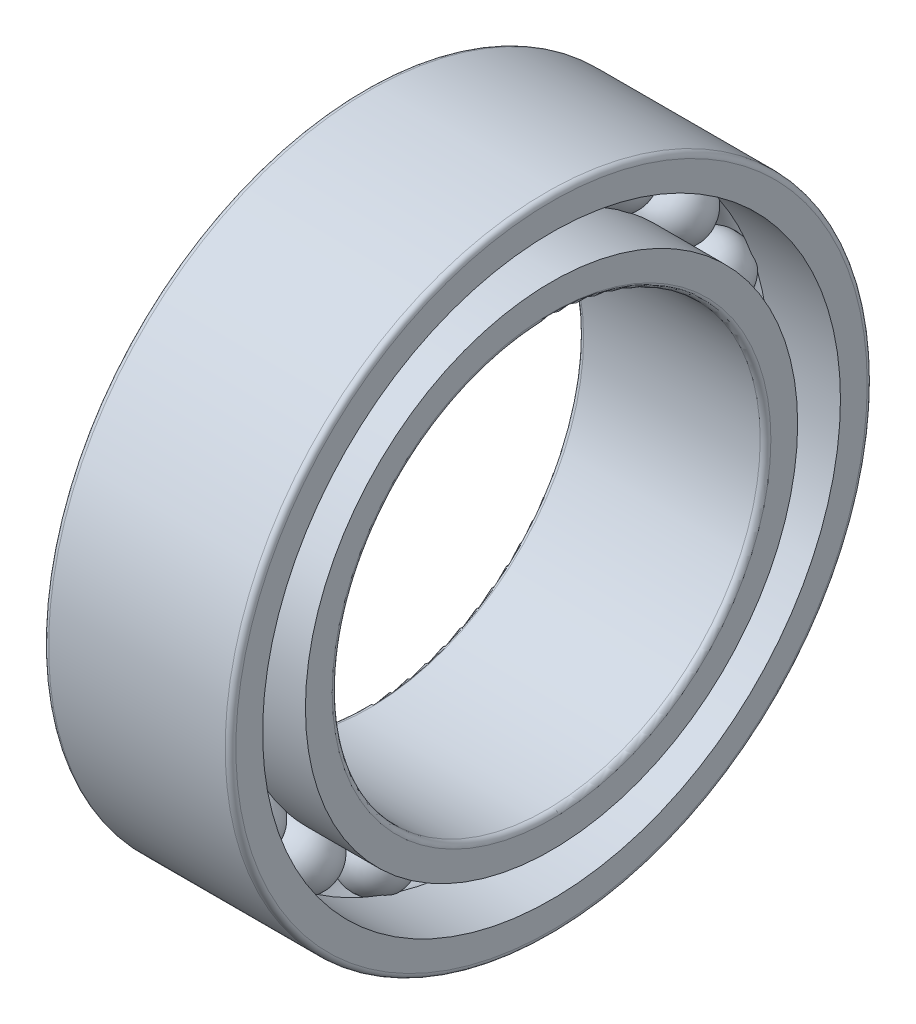
from build123d import *

# Parameters (mm, degrees)
CAGSPISKE_W         = 0.12
CAGSPISKE_H         = 0.2
CAGESPINE_ANGLE     = 0.001
BALLSDETAILED_COUNT = 20
BALLSDETAILED_ANGLE = 342


with BuildPart() as part:
    # CagSpiSke → CageSpine (revolve)
    with BuildSketch(Plane.XY):
        with Locations((0, 5)):
            Rectangle(CAGSPISKE_W, CAGSPISKE_H)
    revolve(axis=Axis((-20.6375, 0, 0), (-1, 0, 0)), revolution_arc=CAGESPINE_ANGLE)

    # BalDetSke → BallDetailed (revolve)
    with BuildSketch(Plane.XY):
        with BuildLine():
            Line((-0.6, 5), (0.6, 5))
            ThreePointArc((0.6, 5), (0, 4.4), (-0.6, 5))
        make_face()
    balldetailed = revolve(axis=Axis((-1.905, 5, 0), (1, 0, 0)))

    # InnRacSke → InnerRace (revolve)
    with BuildSketch(Plane.XY):
        with BuildLine():
            Line((-0.413067791, 4.6), (-1.75, 4.6))
            Line((-1.75, 4.6), (-1.75, 4.1))
            ThreePointArc((-1.75, 4.1), (-1.720710678, 4.029289322), (-1.65, 4))
            Line((-1.65, 4), (1.65, 4))
            ThreePointArc((1.65, 4), (1.720710678, 4.029289322), (1.75, 4.1))
            Line((1.75, 4.1), (1.75, 4.6))
            Line((1.75, 4.6), (0.413067791, 4.6))
            ThreePointArc((0.413067791, 4.6), (0, 4.425), (-0.413067791, 4.6))
        make_face()
    revolve(axis=Axis((-20.6375, 0, 0), (1, 0, 0)))

    # OutRacSke → OuterRace (revolve)
    with BuildSketch(Plane.XY):
        with BuildLine():
            Line((-0.413067791, 5.4), (-1.75, 5.4))
            Line((-1.75, 5.4), (-1.75, 5.9))
            ThreePointArc((-1.75, 5.9), (-1.720710678, 5.970710678), (-1.65, 6))
            Line((-1.65, 6), (1.65, 6))
            ThreePointArc((1.65, 6), (1.720710678, 5.970710678), (1.75, 5.9))
            Line((1.75, 5.9), (1.75, 5.4))
            Line((1.75, 5.4), (0.413067791, 5.4))
            ThreePointArc((0.413067791, 5.4), (0, 5.575), (-0.413067791, 5.4))
        make_face()
    revolve(axis=Axis((-20.6375, 0, 0), (1, 0, 0)))

    # BallsDetailed: BallDetailed ×20 about axis
    ballsdetailed_axis = Axis((-50, 0, 0), (1, 0, 0))
    for i in range(1, BALLSDETAILED_COUNT):
        add(balldetailed.rotate(ballsdetailed_axis, i * BALLSDETAILED_ANGLE / (BALLSDETAILED_COUNT - 1)))


solid = part.part
